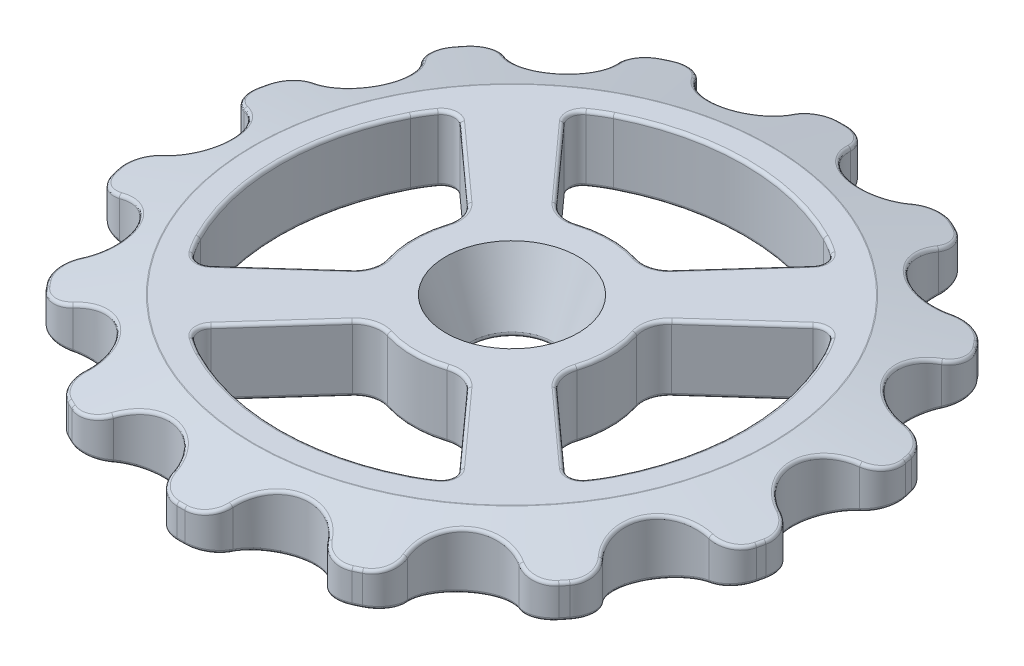
from build123d import *

# Parameters (mm, degrees)
SKETCH_1_W                       = 50
SKETCH_1_H                       = 10
CUT_REVOLVE_START                = -5
CUT_REVOLVE_1_DEPTH              = 10
FILLET_1_R                       = 4
FILLET_2_R                       = 6.5
PATTERN_CIRCULAR_4_COUNT         = 14
FILLET_1_OF_PATTERN_CIRCULAR_4_R = 4
FILLET_2_OF_PATTERN_CIRCULAR_4_R = 6.5
CUT_REVOLVE_2_DEPTH              = 10
SKETCH_4_W                       = 20
SKETCH_4_H                       = 10
CUT_REVOLVE_3_ANGLE              = 15
SKETCH_5_W                       = 20
SKETCH_5_H                       = 10
CUT_REVOLVE_4_ANGLE              = 15
FILLET_4_R                       = 4
FILLET_5_R                       = 2
PATTERN_CIRCULAR_2_COUNT         = 4
FILLET_4_OF_PATTERN_CIRCULAR_2_R = 4
FILLET_5_OF_PATTERN_CIRCULAR_2_R = 2
FILLET_6_R                       = 0.5


# Read off the part's stored shape, not the designer's step: Вырез-Повернуть1, Вырез-Повернуть2
with BuildPart() as part:
    # Эскиз1 → Повернуть1 (revolve)
    with BuildSketch(Plane.XY, mode=Mode.PRIVATE) as revolve_1_sk:
        with Locations((25, 0)):
            Rectangle(SKETCH_1_W, SKETCH_1_H)
    revolve(revolve_1_sk.sketch.rotate(Axis((0, -5, 0), (0, 1, 0)), 90), axis=Axis((0, -5, 0), (0, 1, 0)))

    # Вырез-Повернуть1 outline → Вырез-Повернуть1 (cut)
    with BuildSketch(Plane(origin=(0, 0, 0), x_dir=(1, 0, 0), z_dir=(0, 1, 0)).offset(CUT_REVOLVE_START)):
        with BuildLine():
            Line((-49.494015302, -7.095241316), (-30, 0))
            Line((-30, 0), (-49.494015302, 7.095241316))
            ThreePointArc((-49.494015302, 7.095241316), (-50, 0), (-49.494015302, -7.095241316))
        make_face()
    cut_revolve_1 = extrude(amount=CUT_REVOLVE_1_DEPTH, mode=Mode.SUBTRACT)

    # Скругление1
    fillet_1_edges = [part.edges().sort_by_distance(p)[0] for p in [
        (-49.494015302, 0, -7.095241316),
        (-49.494015302, 0, 7.095241316),
    ]]
    fillet(fillet_1_edges, radius=FILLET_1_R)

    # Скругление2
    fillet_2_edges = [part.edges().sort_by_distance(p)[0] for p in [
        (-30, 0, 0),
    ]]
    fillet(fillet_2_edges, radius=FILLET_2_R)

    # Круговой массив4: Вырез-Повернуть1 ×14 about axis
    pattern_circular_4_axis = Axis((0, 0, 0), (0, 1, 0))
    for i in range(1, PATTERN_CIRCULAR_4_COUNT):
        add(cut_revolve_1.rotate(pattern_circular_4_axis, i * 360 / PATTERN_CIRCULAR_4_COUNT), mode=Mode.SUBTRACT)

    # Скругление1 of Круговой массив4
    fillet_1_of_pattern_circular_4_edges = [part.edges().sort_by_distance(p)[0] for p in [
        (-47.671076767, 0, 15.082056887),
        (-41.514057102, 0, 27.867239959),
        (-36.40629683, 0, 34.272168755),
        (-25.311730757, 0, 43.119789959),
        (-17.930803313, 0, 46.67425728),
        (-4.096105708, 0, 49.831936728),
        (4.096105708, 0, 49.831936728),
        (17.930803313, 0, 46.67425728),
        (25.311730757, 0, 43.119789959),
        (36.40629683, 0, 34.272168755),
        (41.514057102, 0, 27.867239959),
        (47.671076767, 0, 15.082056887),
        (49.494015302, 0, 7.095241316),
        (49.494015302, 0, -7.095241316),
        (47.671076767, 0, -15.082056887),
        (41.514057102, 0, -27.867239959),
        (36.40629683, 0, -34.272168755),
        (25.311730757, 0, -43.119789959),
        (17.930803313, 0, -46.67425728),
        (4.096105708, 0, -49.831936728),
        (-4.096105708, 0, -49.831936728),
        (-17.930803313, 0, -46.67425728),
        (-25.311730757, 0, -43.119789959),
        (-36.40629683, 0, -34.272168755),
        (-41.514057102, 0, -27.867239959),
        (-47.671076767, 0, -15.082056887),
    ]]
    fillet(fillet_1_of_pattern_circular_4_edges, radius=FILLET_1_OF_PATTERN_CIRCULAR_4_R)

    # Скругление2 of Круговой массив4
    fillet_2_of_pattern_circular_4_edges = [part.edges().sort_by_distance(p)[0] for p in [
        (-27.029066037, 0, 13.016512174),
        (-18.704694056, 0, 23.454944474),
        (-6.675628019, 0, 29.247837365),
        (6.675628019, 0, 29.247837365),
        (18.704694056, 0, 23.454944474),
        (27.029066037, 0, 13.016512174),
        (30, 0, 0),
        (27.029066037, 0, -13.016512174),
        (18.704694056, 0, -23.454944474),
        (6.675628019, 0, -29.247837365),
        (-6.675628019, 0, -29.247837365),
        (-18.704694056, 0, -23.454944474),
        (-27.029066037, 0, -13.016512174),
    ]]
    fillet(fillet_2_of_pattern_circular_4_edges, radius=FILLET_2_OF_PATTERN_CIRCULAR_4_R)

    # Эскиз7 → Вырез-Повернуть6 (revolve, cut)
    with BuildSketch(Plane(origin=(0, 0, 0), x_dir=(0, 0, -1), z_dir=(1, 0, 0)), mode=Mode.PRIVATE) as cut_revolve_6_sk:
        Polygon((0, 7.5), (0, -7.5), (5, -7.5), (11, 7.5), align=None)
    revolve(cut_revolve_6_sk.sketch.rotate(Axis((0, 7.5, 0), (0, -1, 0)), 180), axis=Axis((0, 7.5, 0), (0, -1, 0)), mode=Mode.SUBTRACT)

    # Вырез-Повернуть2 outline → Вырез-Повернуть2 (cut)
    with BuildSketch(Plane(origin=(0, 0, 0), x_dir=(1, 0, 0), z_dir=(0, 1, 0)).offset(CUT_REVOLVE_START)):
        with BuildLine():
            ThreePointArc((13.365097863, 6.809857496), (15, 0), (13.365097863, -6.809857496))
            Line((13.365097863, -6.809857496), (31.185228347, -15.889667491))
            ThreePointArc((31.185228347, -15.889667491), (35, 0), (31.185228347, 15.889667491))
            Line((31.185228347, 15.889667491), (13.365097863, 6.809857496))
        make_face()
    cut_revolve_2 = extrude(amount=CUT_REVOLVE_2_DEPTH, mode=Mode.SUBTRACT)

    # Эскиз4 → Вырез-Повернуть3 (revolve, cut)
    with BuildSketch(Plane(origin=(0, 0, 0), x_dir=(0.8910065241883675, 0, -0.45399049973954764), z_dir=(0.4539904997395477, 0, 0.8910065241883676))):
        with Locations((25, 0)):
            Rectangle(SKETCH_4_W, SKETCH_4_H)
    cut_revolve_3 = revolve(axis=Axis((13.365097863, 5, -6.809857496), (0, 1, 0)), revolution_arc=CUT_REVOLVE_3_ANGLE, mode=Mode.SUBTRACT)

    # Эскиз5 → Вырез-Повернуть4 (revolve, cut)
    with BuildSketch(Plane(origin=(0, 0, 0), x_dir=(-0.8910065241883675, 0, -0.45399049973954764), z_dir=(0.4539904997395477, 0, -0.8910065241883676))):
        with Locations((-25, 0)):
            Rectangle(SKETCH_5_W, SKETCH_5_H)
    cut_revolve_4 = revolve(axis=Axis((13.365097863, -5, 6.809857496), (0, -1, 0)), revolution_arc=CUT_REVOLVE_4_ANGLE, mode=Mode.SUBTRACT)

    # Скругление4
    fillet_4_edges = [part.edges().sort_by_distance(p)[0] for p in [
        (13.365097863, 0, -6.809857496),
        (13.365097863, 0, 6.809857496),
    ]]
    fillet(fillet_4_edges, radius=FILLET_4_R)

    # Скругление5
    fillet_5_edges = [part.edges().sort_by_distance(p)[0] for p in [
        (28.227994372, 0, -20.192469623),
        (28.227994372, 0, 20.192469623),
    ]]
    fillet(fillet_5_edges, radius=FILLET_5_R)

    # Круговой массив2: Вырез-Повернуть2, Вырез-Повернуть3, Вырез-Повернуть4 ×4 about axis
    pattern_circular_2_axis = Axis((0, 0, 0), (0, 1, 0))
    add([cut_revolve_2.rotate(pattern_circular_2_axis, i * 360 / PATTERN_CIRCULAR_2_COUNT) for i in range(1, PATTERN_CIRCULAR_2_COUNT)], mode=Mode.SUBTRACT)
    add([cut_revolve_3.rotate(pattern_circular_2_axis, i * 360 / PATTERN_CIRCULAR_2_COUNT) for i in range(1, PATTERN_CIRCULAR_2_COUNT)], mode=Mode.SUBTRACT)
    add([cut_revolve_4.rotate(pattern_circular_2_axis, i * 360 / PATTERN_CIRCULAR_2_COUNT) for i in range(1, PATTERN_CIRCULAR_2_COUNT)], mode=Mode.SUBTRACT)

    # Скругление4 of Круговой массив2
    fillet_4_of_pattern_circular_2_edges = [part.edges().sort_by_distance(p)[0] for p in [
        (-6.809857496, 0, -13.365097863),
        (6.809857496, 0, -13.365097863),
        (-13.365097863, 0, 6.809857496),
        (-13.365097863, 0, -6.809857496),
        (6.809857496, 0, 13.365097863),
        (-6.809857496, 0, 13.365097863),
    ]]
    fillet(fillet_4_of_pattern_circular_2_edges, radius=FILLET_4_OF_PATTERN_CIRCULAR_2_R)

    # Скругление5 of Круговой массив2
    fillet_5_of_pattern_circular_2_edges = [part.edges().sort_by_distance(p)[0] for p in [
        (-20.192469623, 0, -28.227994372),
        (20.192469623, 0, -28.227994372),
        (-28.227994372, 0, 20.192469623),
        (-28.227994372, 0, -20.192469623),
        (20.192469623, 0, 28.227994372),
        (-20.192469623, 0, 28.227994372),
    ]]
    fillet(fillet_5_of_pattern_circular_2_edges, radius=FILLET_5_OF_PATTERN_CIRCULAR_2_R)

    # Эскиз8 → Вырез-Повернуть7 (revolve, cut)
    with BuildSketch(Plane(origin=(0, 0, 0), x_dir=(0, 0, -1), z_dir=(1, 0, 0)), mode=Mode.PRIVATE) as cut_revolve_7_sk:
        Polygon((-52, 2), (-39, 5), (-52, 5), align=None)
    cut_revolve_7 = revolve(cut_revolve_7_sk.sketch.rotate(Axis((0, -7.5, 0), (0, 1, 0)), 179.320619377), axis=Axis((0, -7.5, 0), (0, 1, 0)), mode=Mode.SUBTRACT)

    # Зеркальное отражение1: Вырез-Повернуть7 across plane
    add(cut_revolve_7.mirror(Plane.ZX), mode=Mode.SUBTRACT)

    # Скругление6
    fillet_6_edges = [part.edges().sort_by_distance(p)[0] for p in [
        (0, -5, -6),
        (35, 5, 0),
        (35, -5, 0),
        (15, 5, 0),
        (15, -5, 0),
        (21.05200255, 5, 13.731177564),
        (21.05200255, -5, -13.731177564),
        (14.262596363, -5, 6.762618572),
        (14.262596363, 5, 6.762618572),
        (14.262596363, -5, -6.762618572),
        (14.262596363, 5, -6.762618572),
        (21.05200255, -5, 13.731177564),
        (30.45240362, 5, 17.203316111),
        (30.45240362, -5, 17.203316111),
        (21.05200255, 5, -13.731177564),
        (30.45240362, -5, -17.203316111),
        (30.45240362, 5, -17.203316111),
        (28.212778607, -5, 19.2816808),
        (28.212778607, 5, 19.2816808),
        (28.212778607, 5, -19.2816808),
        (28.212778607, -5, -19.2816808),
        (0, 5, 35),
        (0, -5, 35),
        (-35, 5, 0),
        (-35, -5, 0),
        (0, 5, -35),
        (0, -5, -35),
        (0, 5, 15),
        (0, -5, 15),
        (-13.731177564, 5, 21.05200255),
        (13.731177564, -5, 21.05200255),
        (-6.762618572, -5, 14.262596363),
        (-6.762618572, 5, 14.262596363),
        (6.762618572, -5, 14.262596363),
        (6.762618572, 5, 14.262596363),
        (-15, 5, 0),
        (-15, -5, 0),
        (-21.05200255, 5, -13.731177564),
        (-21.05200255, -5, 13.731177564),
        (-14.262596363, -5, -6.762618572),
        (-14.262596363, 5, -6.762618572),
        (-14.262596363, -5, 6.762618572),
        (-14.262596363, 5, 6.762618572),
        (0, 5, -15),
        (0, -5, -15),
        (13.731177564, 5, -21.05200255),
        (-13.731177564, -5, -21.05200255),
        (6.762618572, -5, -14.262596363),
        (6.762618572, 5, -14.262596363),
        (-6.762618572, -5, -14.262596363),
        (-6.762618572, 5, -14.262596363),
        (-13.731177564, -5, 21.05200255),
        (-17.203316111, 5, 30.45240362),
        (-17.203316111, -5, 30.45240362),
        (13.731177564, 5, 21.05200255),
        (17.203316111, -5, 30.45240362),
        (17.203316111, 5, 30.45240362),
        (-19.2816808, -5, 28.212778607),
        (-19.2816808, 5, 28.212778607),
        (19.2816808, 5, 28.212778607),
        (19.2816808, -5, 28.212778607),
        (-21.05200255, -5, -13.731177564),
        (-30.45240362, 5, -17.203316111),
        (-30.45240362, -5, -17.203316111),
        (-21.05200255, 5, 13.731177564),
        (-30.45240362, -5, 17.203316111),
        (-30.45240362, 5, 17.203316111),
        (-28.212778607, -5, -19.2816808),
        (-28.212778607, 5, -19.2816808),
        (-28.212778607, 5, 19.2816808),
        (-28.212778607, -5, 19.2816808),
        (13.731177564, -5, -21.05200255),
        (17.203316111, 5, -30.45240362),
        (17.203316111, -5, -30.45240362),
        (-13.731177564, 5, -21.05200255),
        (-17.203316111, -5, -30.45240362),
        (-17.203316111, 5, -30.45240362),
        (19.2816808, -5, -28.212778607),
        (19.2816808, 5, -28.212778607),
        (-19.2816808, 5, -28.212778607),
        (-19.2816808, -5, -28.212778607),
        (-38.269932526, 4.197749106, 18.429828168),
        (-0.462428885, 5, 38.997258359),
        (38.269932526, 4.197749106, -18.429828168),
        (42.47642054, 4.197749106, 0),
        (38.269932526, 4.197749106, 18.429828168),
        (26.483615026, 4.197749106, 33.209402841),
        (9.45189277, 4.197749106, 41.411447994),
        (-9.45189277, 4.197749106, 41.411447994),
        (-26.483615026, 4.197749106, 33.209402841),
        (-42.47642054, 4.197749106, 0),
        (-38.269932526, 4.197749106, -18.429828168),
        (-26.483615026, 4.197749106, -33.209402841),
        (-9.45189277, 4.197749106, -41.411447994),
        (9.45189277, 4.197749106, -41.411447994),
        (26.483615026, 4.197749106, -33.209402841),
        (40.298708169, 2.663331262, -28.095110082),
        (39.091574123, 2.461538462, -31.174490093),
        (36.358013194, 2.663331262, -33.036585283),
        (24.117870063, 2.663331262, -42.797773706),
        (21.694186956, 2.461538462, -45.048443395),
        (18.423400836, 2.663331262, -45.540085553),
        (3.160192005, 2.663331262, -49.023813367),
        (0, 2.461538462, -50),
        (-3.160192005, 2.663331262, -49.023813367),
        (-18.423400836, 2.663331262, -45.540085554),
        (-21.694186956, 2.461538462, -45.048443395),
        (-24.117870063, 2.663331262, -42.797773706),
        (-36.358013194, 2.663331262, -33.036585283),
        (-39.091574123, 2.461538462, -31.174490093),
        (-40.298708168, 2.663331262, -28.095110082),
        (-47.091475137, 2.663331262, -13.989784131),
        (-48.746395609, 2.461538462, -11.126046698),
        (-48.49789289, 2.663331262, -7.827865342),
        (-48.49789289, 2.663331262, 7.827865342),
        (-48.746395609, 2.461538462, 11.126046698),
        (-47.091475136, 2.663331262, 13.98978413),
        (-40.298708169, 2.663331262, 28.095110082),
        (-39.091574123, 2.461538462, 31.174490093),
        (-36.358013194, 2.663331262, 33.036585283),
        (-24.117870063, 2.663331262, 42.797773706),
        (-21.694186956, 2.461538462, 45.048443395),
        (-18.423400836, 2.663331262, 45.540085553),
        (-3.160192006, 2.663331262, 49.023813367),
        (0, 2.461538462, 50),
        (3.160192005, 2.663331262, 49.023813367),
        (18.423400836, 2.663331262, 45.540085554),
        (21.694186956, 2.461538462, 45.048443395),
        (24.117870063, 2.663331262, 42.797773706),
        (36.358013194, 2.663331262, 33.036585283),
        (39.091574123, 2.461538462, 31.174490093),
        (40.298708168, 2.663331262, 28.095110082),
        (47.091475137, 2.663331262, 13.989784131),
        (48.746395609, 2.461538462, 11.126046698),
        (48.497892889, 2.663331262, 7.827865343),
        (48.49789289, 2.663331262, -7.827865342),
        (48.746395609, 2.461538462, -11.126046698),
        (47.091475136, 2.663331262, -13.98978413),
        (-38.269932526, -4.197749106, 18.429828168),
        (38.269932526, -4.197749106, -18.429828168),
        (26.483615026, -4.197749106, -33.209402841),
        (9.45189277, -4.197749106, -41.411447994),
        (-9.45189277, -4.197749106, -41.411447994),
        (-26.483615026, -4.197749106, -33.209402841),
        (-38.269932526, -4.197749106, -18.429828168),
        (-42.47642054, -4.197749106, 0),
        (-26.483615026, -4.197749106, 33.209402841),
        (-9.45189277, -4.197749106, 41.411447994),
        (9.45189277, -4.197749106, 41.411447994),
        (26.483615026, -4.197749106, 33.209402841),
        (38.269932526, -4.197749106, 18.429828168),
        (42.47642054, -4.197749106, 0),
        (-0.462428885, -5, 38.997258359),
        (47.091475136, -2.663331262, -13.98978413),
        (48.746395609, -2.461538462, -11.126046698),
        (48.49789289, -2.663331262, -7.827865342),
        (48.497892889, -2.663331262, 7.827865343),
        (48.746395609, -2.461538462, 11.126046698),
        (47.091475137, -2.663331262, 13.989784131),
        (40.298708168, -2.663331262, 28.095110082),
        (39.091574123, -2.461538462, 31.174490093),
        (36.358013194, -2.663331262, 33.036585283),
        (24.117870063, -2.663331262, 42.797773706),
        (21.694186956, -2.461538462, 45.048443395),
        (18.423400836, -2.663331262, 45.540085554),
        (3.160192005, -2.663331262, 49.023813367),
        (0, -2.461538462, 50),
        (-3.160192006, -2.663331262, 49.023813367),
        (-18.423400836, -2.663331262, 45.540085553),
        (-21.694186956, -2.461538462, 45.048443395),
        (-24.117870063, -2.663331262, 42.797773706),
        (-36.358013194, -2.663331262, 33.036585283),
        (-39.091574123, -2.461538462, 31.174490093),
        (-40.298708169, -2.663331262, 28.095110082),
        (-47.091475136, -2.663331262, 13.98978413),
        (-48.746395609, -2.461538462, 11.126046698),
        (-48.49789289, -2.663331262, 7.827865342),
        (-48.49789289, -2.663331262, -7.827865342),
        (-48.746395609, -2.461538462, -11.126046698),
        (-47.091475137, -2.663331262, -13.989784131),
        (-40.298708168, -2.663331262, -28.095110082),
        (-39.091574123, -2.461538462, -31.174490093),
        (-36.358013194, -2.663331262, -33.036585283),
        (-24.117870063, -2.663331262, -42.797773706),
        (-21.694186956, -2.461538462, -45.048443395),
        (-18.423400836, -2.663331262, -45.540085554),
        (-3.160192005, -2.663331262, -49.023813367),
        (0, -2.461538462, -50),
        (3.160192005, -2.663331262, -49.023813367),
        (18.423400836, -2.663331262, -45.540085553),
        (21.694186956, -2.461538462, -45.048443395),
        (24.117870063, -2.663331262, -42.797773706),
        (36.358013194, -2.663331262, -33.036585283),
        (39.091574123, -2.461538462, -31.174490093),
        (40.298708169, -2.663331262, -28.095110082),
    ]]
    fillet(fillet_6_edges, radius=FILLET_6_R)


solid = part.part
